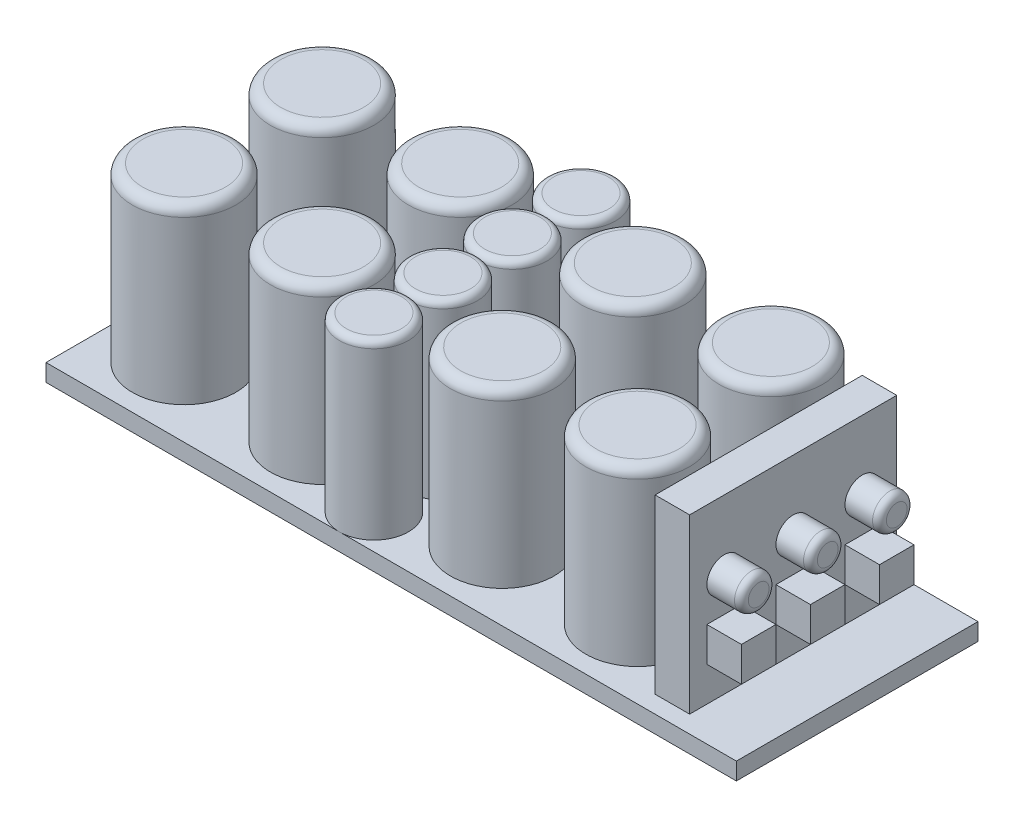
from build123d import *

# Parameters (mm, degrees)
SKETCH1_W            = 127
SKETCH1_H            = 50.8
BOSS_EXTRUDE1_DEPTH  = 3.175
SKETCH2_W            = 19.05
SKETCH2_H            = 6.35
CUT_EXTRUDE1_DEPTH   = 3.175
SKETCH3_R            = 6.35
BOSS_EXTRUDE17_DEPTH = 31.75
SKETCH6_R            = 6.35
BOSS_EXTRUDE19_DEPTH = 31.75
SKETCH7_R            = 6.35
BOSS_EXTRUDE20_DEPTH = 31.75
SKETCH8_R            = 9.525
BOSS_EXTRUDE21_DEPTH = 31.75
SKETCH9_W            = 6.35
SKETCH9_H            = 38.1
BOSS_EXTRUDE22_DEPTH = 31.75
SKETCH11_W           = 6.35
SKETCH11_H           = 6.35
BOSS_EXTRUDE23_DEPTH = 6.35
FILLET5_R            = 1.905
FILLET7_R            = 1.27
FILLET9_R            = 1.27
FILLET10_R           = 1.27
SKETCH5_R            = 6.35
BOSS_EXTRUDE24_DEPTH = 31.75
SKETCH12_R           = 3.175
BOSS_EXTRUDE25_DEPTH = 6.35
FILLET12_R           = 1.27


with BuildPart() as part:
    # Sketch1 → Boss-Extrude1 (new body)
    with BuildSketch(Plane(origin=(0, 0, 0), x_dir=(1, 0, 0), z_dir=(0, 1, 0))):
        with Locations((63.5, 25.4)):
            Rectangle(SKETCH1_W, SKETCH1_H)
    extrude(amount=BOSS_EXTRUDE1_DEPTH)

    # Sketch2 → Cut-Extrude1 (cut)
    with BuildSketch(Plane(origin=(0, 3.175, 0), x_dir=(1, 0, 0), z_dir=(0, 1, 0))):
        with Locations((117.475, 47.625)):
            Rectangle(SKETCH2_W, SKETCH2_H)
    extrude(amount=-CUT_EXTRUDE1_DEPTH, mode=Mode.SUBTRACT)

    # Sketch3 → Boss-Extrude17 (add)
    with BuildSketch(Plane(origin=(0, 3.175, 0), x_dir=(1, 0, 0), z_dir=(0, 1, 0))):
        with Locations(Location((53.975, 44.45, 0), (0, 0, 90))):
            Circle(SKETCH3_R)
    extrude(amount=BOSS_EXTRUDE17_DEPTH)

    # Sketch6 → Boss-Extrude19 (add)
    with BuildSketch(Plane(origin=(0, 3.175, 0), x_dir=(1, 0, 0), z_dir=(0, 1, 0))):
        with Locations(Location((53.975, 19.0499746, 0), (0, 0, 90))):
            Circle(SKETCH6_R)
    extrude(amount=BOSS_EXTRUDE19_DEPTH)

    # Sketch7 → Boss-Extrude20 (add)
    with BuildSketch(Plane(origin=(0, 3.175, 0), x_dir=(1, 0, 0), z_dir=(0, 1, 0))):
        with Locations(Location((53.975, 6.349746, 0), (0, 0, 269.48752926))):
            Circle(SKETCH7_R)
    extrude(amount=BOSS_EXTRUDE20_DEPTH)

    # Sketch8 → Boss-Extrude21 (add)
    with BuildSketch(Plane(origin=(0, 3.175, 0), x_dir=(1, 0, 0), z_dir=(0, 1, 0))):
        with Locations(Location((12.7, 38.1, 0), (0, 0, 90))):
            Circle(SKETCH8_R)
        with Locations(Location((12.7, 12.7, 0), (0, 0, 90))):
            Circle(SKETCH8_R)
        with Locations(Location((38.1, 38.1, 0), (0, 0, 90))):
            Circle(SKETCH8_R)
        with Locations(Location((38.1, 12.7, 0), (0, 0, 90))):
            Circle(SKETCH8_R)
        with Locations(Location((69.85, 38.1, 0), (0, 0, 90))):
            Circle(SKETCH8_R)
        with Locations(Location((71.226973821, 12.7, 0), (0, 0, 90))):
            Circle(SKETCH8_R)
        with Locations(Location((95.25, 38.1, 0), (0, 0, 90))):
            Circle(SKETCH8_R)
        with Locations(Location((96.126256068, 12.7, 0), (0, 0, 90))):
            Circle(SKETCH8_R)
    extrude(amount=BOSS_EXTRUDE21_DEPTH)

    # Sketch9 → Boss-Extrude22 (add)
    with BuildSketch(Plane(origin=(0, 3.175, 0), x_dir=(1, 0, 0), z_dir=(0, 1, 0))):
        with Locations((112.052546384, 22.225)):
            Rectangle(SKETCH9_W, SKETCH9_H)
    extrude(amount=BOSS_EXTRUDE22_DEPTH)

    # Sketch11 → Boss-Extrude23 (add)
    with BuildSketch(Plane(origin=(115.227546384, 0, 0), x_dir=(0, 0, -1), z_dir=(1, 0, 0))):
        with Locations((9.525, 12.7)):
            Rectangle(SKETCH11_W, SKETCH11_H)
        with Locations((22.225, 12.7)):
            Rectangle(SKETCH11_W, SKETCH11_H)
        with Locations((34.925, 12.7)):
            Rectangle(SKETCH11_W, SKETCH11_H)
    extrude(amount=BOSS_EXTRUDE23_DEPTH)

    # Fillet5
    fillet5_edges = [part.edges().sort_by_distance(p)[0] for p in [
        (12.7, 34.925, -3.175),
        (12.7, 34.925, -28.575),
        (38.1, 34.925, -28.575),
        (38.1, 34.925, -3.175),
        (69.85, 34.925, -28.575),
        (71.226973821, 34.925, -3.175),
        (96.126256068, 34.925, -3.175),
        (95.25, 34.925, -28.575),
    ]]
    fillet(fillet5_edges, radius=FILLET5_R)

    # Fillet7
    fillet7_edges = [part.edges().sort_by_distance(p)[0] for p in [
        (54.031795559, 34.925, -12.699492),
    ]]
    fillet(fillet7_edges, radius=FILLET7_R)

    # Fillet9
    fillet9_edges = [part.edges().sort_by_distance(p)[0] for p in [
        (53.975, 34.925, -38.1),
    ]]
    fillet(fillet9_edges, radius=FILLET9_R)

    # Fillet10
    fillet10_edges = [part.edges().sort_by_distance(p)[0] for p in [
        (53.975, 34.925, -12.6999746),
    ]]
    fillet(fillet10_edges, radius=FILLET10_R)

    # Sketch5 → Boss-Extrude24 (add)
    with BuildSketch(Plane(origin=(0, 3.175, 0), x_dir=(1, 0, 0), z_dir=(0, 1, 0))):
        with Locations(Location((54.048956129, 31.749746, 0), (0, 0, 269.583541403))):
            Circle(SKETCH5_R)
    extrude(amount=BOSS_EXTRUDE24_DEPTH)

    # Fillet11: read off the stored shape, not the designer's step
    # Fillet11 outline → Fillet11 (revolve, cut)
    with BuildSketch(Plane(origin=(54.048956129, 0, -31.749746), x_dir=(1, 0, 0), z_dir=(0, 0, 1))):
        with BuildLine():
            ThreePointArc((5.08, 34.925), (5.978025612, 34.553025612), (6.35, 33.655))
            Line((6.35, 33.655), (6.35, 34.925))
            Line((6.35, 34.925), (5.08, 34.925))
        make_face()
    revolve(axis=Axis((54.048956129, 0, -31.749746), (0, 1, 0)), mode=Mode.SUBTRACT)

    # Sketch12 → Boss-Extrude25 (add)
    with BuildSketch(Plane(origin=(115.227546384, 0, 0), x_dir=(0, 0, -1), z_dir=(1, 0, 0))):
        with Locations(Location((9.525, 22.225, 0), (0, 0, 180))):
            Circle(SKETCH12_R)
        with Locations(Location((22.225, 22.225, 0), (0, 0, 180))):
            Circle(SKETCH12_R)
        with Locations(Location((34.925, 22.225, 0), (0, 0, 180))):
            Circle(SKETCH12_R)
    extrude(amount=BOSS_EXTRUDE25_DEPTH)

    # Fillet12
    fillet12_edges = [part.edges().sort_by_distance(p)[0] for p in [
        (121.577546384, 22.225, -12.7),
        (121.577546384, 22.225, -25.4),
        (121.577546384, 22.225, -38.1),
    ]]
    fillet(fillet12_edges, radius=FILLET12_R)


solid = part.part
